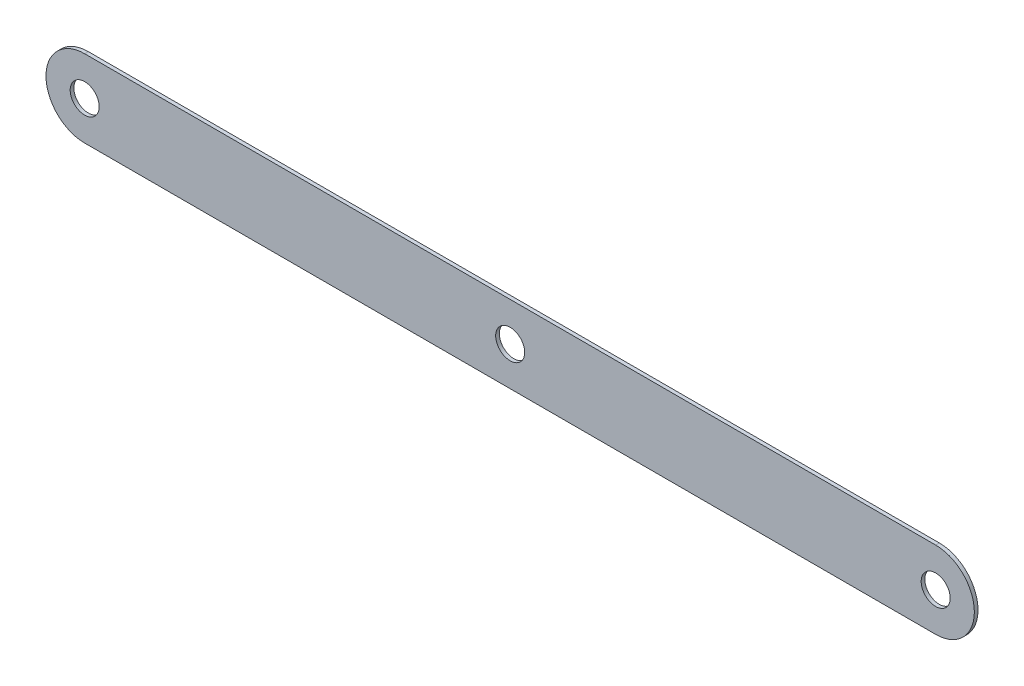
from build123d import *

# Parameters (mm, degrees)
BOSS_EXTRUDE1_DEPTH = 1.2
SKETCH2_R           = 4.7625
CUT_EXTRUDE1_DEPTH  = 153.932959168
SKETCH3_R           = 4.7625
CUT_EXTRUDE2_DEPTH  = 153.932959168


with BuildPart() as part:
    # Sketch1 → Boss-Extrude1 (new body)
    with BuildSketch(Plane.XY):
        with BuildLine():
            Line((139.7, 12.7), (-139.7, 12.7))
            ThreePointArc((-139.7, 12.7), (-152.4, 0), (-139.7, -12.7))
            Line((-139.7, -12.7), (139.7, -12.7))
            ThreePointArc((139.7, -12.7), (152.4, 0), (139.7, 12.7))
        make_face()
    extrude(amount=BOSS_EXTRUDE1_DEPTH)

    # Sketch2 → Cut-Extrude1 (cut, through all)
    with BuildSketch(Plane.XY.offset(1.2)):
        Circle(SKETCH2_R)
    extrude(amount=-CUT_EXTRUDE1_DEPTH, mode=Mode.SUBTRACT)

    # Sketch3 → Cut-Extrude2 (cut, through all)
    with BuildSketch(Plane.XY.offset(1.2)):
        with Locations((-139.7, 0)):
            Circle(SKETCH3_R)
        with Locations((139.7, 0)):
            Circle(SKETCH3_R)
    extrude(amount=-CUT_EXTRUDE2_DEPTH, mode=Mode.SUBTRACT)


solid = part.part
